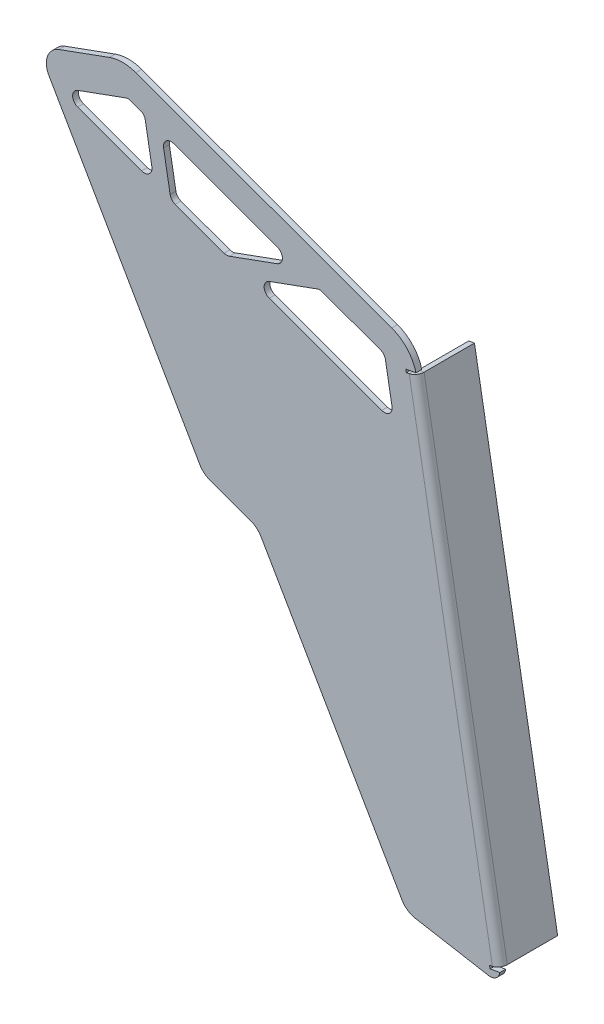
from build123d import *

# Parameters (mm, degrees)
RESSALTO_EXTRUS_O1_DEPTH        = 3
ARESTA_FLANGE1_STRIP_W          = 13.8
ARESTA_FLANGE1_STRIP_H          = 3
ARESTA_FLANGE1_STRIP_CUT_DEPTH  = 248.223813341
ARESTA_FLANGE1_RELIEF_W         = 15.3
ARESTA_FLANGE1_RELIEF_H         = 1.5
ARESTA_FLANGE1_RELIEF_CUT_DEPTH = 3
ARESTA_FLANGE1_DEPTH            = 248.223813341


# Sheet-metal steps are written as plain solids
with BuildPart() as part:
    # Esboço29 → Ressalto-extrusão1 (new body)
    with BuildSketch(Plane.XY):
        with BuildLine():
            Line((423.645620755, 59.178719541), (380.542007914, 303.631455401))
            ThreePointArc((380.542007914, 303.631455401), (376.166741716, 313.014244041), (367.686255721, 318.952344263))
            Line((367.686255721, 318.952344263), (235.026475013, 367.236555725))
            ThreePointArc((235.026475013, 367.236555725), (228.186072146, 368.44270331), (221.34566928, 367.236555725))
            Line((221.34566928, 367.236555725), (195.221638123, 357.728185985))
            ThreePointArc((195.221638123, 357.728185985), (189.244913348, 351.75146121), (189.981585518, 343.331259777))
            Line((189.981585518, 343.331259777), (268.150737271, 207.938317356))
            ThreePointArc((268.150737271, 207.938317356), (270.383115212, 205.277872925), (273.390789876, 203.541391148))
            Line((273.390789876, 203.541391148), (294.669915314, 195.796422877))
            ThreePointArc((294.669915314, 195.796422877), (297.677589977, 194.059941101), (299.909967918, 191.399496669))
            Line((299.909967918, 191.399496669), (372.923716413, 64.935974625))
            ThreePointArc((372.923716413, 64.935974625), (375.848206088, 61.744454182), (379.847488675, 60.087897095))
            Line((379.847488675, 60.087897095), (417.853341101, 53.386439887))
            ThreePointArc((417.853341101, 53.386439887), (422.257115895, 54.774944746), (423.645620755, 59.178719541))
        make_face()
        with BuildLine():
            Line((243.325022214, 329.098265065), (239.916324262, 348.429951789))
            ThreePointArc((239.916324262, 348.429951789), (239.041271023, 350.306509517), (237.345173823, 351.494129561))
            Line((237.345173823, 351.494129561), (232.47795712, 353.265651565))
            ThreePointArc((232.47795712, 353.265651565), (231.109876546, 353.506881082), (229.741795973, 353.265651565))
            Line((229.741795973, 353.265651565), (204.889458572, 344.220140499))
            ThreePointArc((204.889458572, 344.220140499), (202.257539145, 340.461370016), (204.889458572, 336.702599533))
            Line((204.889458572, 336.702599533), (238.017710629, 324.644901871))
            ThreePointArc((238.017710629, 324.644901871), (241.956941641, 325.339494581), (243.325022214, 329.098265065))
        make_face(mode=Mode.SUBTRACT)
        with BuildLine():
            Line((249.39887944, 340.721872869), (252.807577392, 321.390186145))
            ThreePointArc((252.807577392, 321.390186145), (253.682630632, 319.513628417), (255.378727831, 318.326008373))
            Line((255.378727831, 318.326008373), (280.757120558, 309.089028826))
            ThreePointArc((280.757120558, 309.089028826), (282.125201132, 308.847799309), (283.493281705, 309.089028826))
            Line((283.493281705, 309.089028826), (308.345619106, 318.134539892))
            ThreePointArc((308.345619106, 318.134539892), (310.977538533, 321.893310376), (308.345619106, 325.652080859))
            Line((308.345619106, 325.652080859), (254.706191026, 345.175236063))
            ThreePointArc((254.706191026, 345.175236063), (250.766960014, 344.480643352), (249.39887944, 340.721872869))
        make_face(mode=Mode.SUBTRACT)
        with BuildLine():
            Line((328.999893161, 317.138658679), (304.14755576, 308.093147613))
            ThreePointArc((304.14755576, 308.093147613), (301.515636333, 304.33437713), (304.14755576, 300.575606647))
            Line((304.14755576, 300.575606647), (362.485446944, 279.342350725))
            ThreePointArc((362.485446944, 279.342350725), (366.424677956, 280.036943436), (367.79275853, 283.795713919))
            Line((367.79275853, 283.795713919), (364.384060578, 303.127400644))
            ThreePointArc((364.384060578, 303.127400644), (363.509007338, 305.003958372), (361.812910139, 306.191578416))
            Line((361.812910139, 306.191578416), (331.736054308, 317.138658679))
            ThreePointArc((331.736054308, 317.138658679), (330.367973734, 317.379888196), (328.999893161, 317.138658679))
        make_face(mode=Mode.SUBTRACT)
    extrude(amount=RESSALTO_EXTRUS_O1_DEPTH)

    # Aresta-Flange1 strip (across the edge) → Aresta-Flange1 strip cut (cut)
    with BuildSketch(Plane(origin=(380.542007914, 303.631455401, 0), x_dir=(-0.9848077530122086, -0.17364817766692797, -3.491481338843133e-15), z_dir=(0.17364817766692797, -0.9848077530122086, 0))):
        with Locations((-3, -1.5)):
            Rectangle(ARESTA_FLANGE1_STRIP_W, ARESTA_FLANGE1_STRIP_H)
    extrude(amount=ARESTA_FLANGE1_STRIP_CUT_DEPTH, mode=Mode.SUBTRACT)

    # Aresta-Flange1 relief (on the sheet) → Aresta-Flange1 relief cut (cut)
    with BuildSketch(Plane(origin=(376.701257678, 302.954227508, 0), x_dir=(-0.9848077530122086, -0.17364817766692797, -6.982962677686267e-15), z_dir=(0, 0, -1))):
        with Locations((-6.15, 0.75)):
            Rectangle(ARESTA_FLANGE1_RELIEF_W, ARESTA_FLANGE1_RELIEF_H)
        with Locations((-6.15, -248.973813341)):
            Rectangle(ARESTA_FLANGE1_RELIEF_W, ARESTA_FLANGE1_RELIEF_H)
    extrude(amount=-ARESTA_FLANGE1_RELIEF_CUT_DEPTH, mode=Mode.SUBTRACT)

    # Aresta-Flange1 section (across the edge) → Aresta-Flange1 (add)
    with BuildSketch(Plane(origin=(380.542007914, 303.631455401, 0), x_dir=(-0.9848077530122086, -0.17364817766692797, -3.491481338843133e-15), z_dir=(0.17364817766692797, -0.9848077530122086, 0))):
        with BuildLine():
            Line((0, 0.9), (0, 27))
            Line((0, 27), (3, 27))
            Line((3, 27), (3, 0.9))
            ThreePointArc((3, 0.9), (3.263603897, 0.263603897), (3.9, 0))
            Line((3.9, 0), (3.9, -3))
            ThreePointArc((3.9, -3), (1.142283553, -1.857716447), (0, 0.9))
        make_face()
    extrude(amount=ARESTA_FLANGE1_DEPTH)


solid = part.part
